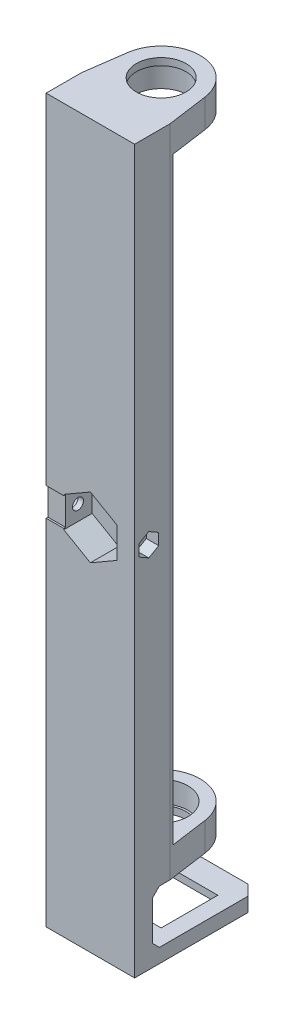
from build123d import *

# Parameters (mm, degrees)
BOSS_EXTRUDE1_DEPTH = 200
SKETCH4_R           = 7
CUT_EXTRUDE2_DEPTH  = 200
SKETCH3_W           = 20
SKETCH3_H           = 169
SKETCH3_W_2         = 21
SKETCH3_H_2         = 15
CUT_EXTRUDE1_DEPTH  = 100
SKETCH5_R           = 7.565
CUT_EXTRUDE3_DEPTH  = 6
CUT_EXTRUDE4_START  = -6
SKETCH6_R           = 7.565
CUT_EXTRUDE4_DEPTH  = 6
CUT_EXTRUDE8_START  = -100
SKETCH11_W          = 7
SKETCH11_H          = 2
CUT_EXTRUDE8_DEPTH  = 4
SKETCH13_W          = 16
SKETCH13_H          = 16
BOSS_EXTRUDE3_DEPTH = 4
SKETCH14_W          = 5
SKETCH14_H          = 15
CUT_EXTRUDE11_DEPTH = 203.546291005
CHAMFER1_SIZE       = 2
SKETCH15_W          = 23
SKETCH15_H          = 23
CUT_EXTRUDE12_DEPTH = 2
CUT_EXTRUDE13_DEPTH = 8
SKETCH17_R          = 1.55
CUT_EXTRUDE14_DEPTH = 203.546291005
SKETCH18_R          = 2.75
CUT_EXTRUDE15_DEPTH = 3.5
CUT_EXTRUDE16_DEPTH = 3.5
FILLET2_R           = 1


with BuildPart() as part:
    # Sketch1 → Boss-Extrude1 (new body)
    with BuildSketch(Plane(origin=(0, 0, 0), x_dir=(1, 0, 0), z_dir=(0, 1, 0))):
        with BuildLine():
            Line((-12.5, -10), (-10.894701926, 1.518377407))
            ThreePointArc((-10.894701926, 1.518377407), (0, 11), (10.894701926, 1.518377407))
            Line((10.894701926, 1.518377407), (12.5, -10))
            Line((12.5, -10), (12.5, -20))
            Line((12.5, -20), (-12.5, -20))
            Line((-12.5, -20), (-12.5, -10))
        make_face()
    extrude(amount=BOSS_EXTRUDE1_DEPTH)

    # Sketch4 → Cut-Extrude2 (cut)
    with BuildSketch(Plane.XZ):
        with Locations(Location((0, 0, 0), (0, 0, 270))):
            Circle(SKETCH4_R)
    extrude(amount=-CUT_EXTRUDE2_DEPTH, mode=Mode.SUBTRACT)

    # Sketch3 → Cut-Extrude1 (cut, symmetric)
    with BuildSketch(Plane(origin=(0, 0, 0), x_dir=(0, 0, -1), z_dir=(1, 0, 0))):
        with Locations((1, 107.5)):
            Rectangle(SKETCH3_W, SKETCH3_H)
        with Locations((0.5, 7.5)):
            Rectangle(SKETCH3_W_2, SKETCH3_H_2)
    extrude(amount=CUT_EXTRUDE1_DEPTH, both=True, mode=Mode.SUBTRACT)

    # Sketch5 → Cut-Extrude3 (cut)
    with BuildSketch(Plane.XZ.offset(-192)):
        with Locations(Location((0, 0, 0), (0, 0, 270))):
            Circle(SKETCH5_R)
    extrude(amount=-CUT_EXTRUDE3_DEPTH, mode=Mode.SUBTRACT)

    # Sketch6 → Cut-Extrude4 (cut)
    with BuildSketch(Plane(origin=(0, 23, 0), x_dir=(1, 0, 0), z_dir=(0, 1, 0)).offset(CUT_EXTRUDE4_START)):
        with Locations(Location((0, 0, 0), (0, 0, 90))):
            Circle(SKETCH6_R)
    extrude(amount=CUT_EXTRUDE4_DEPTH, mode=Mode.SUBTRACT)

    # Sketch11 → Cut-Extrude8 (cut, symmetric)
    with BuildSketch(Plane.XZ.offset(CUT_EXTRUDE8_START)):
        with Locations((-9, 20.5)):
            Rectangle(SKETCH11_W, SKETCH11_H)
    extrude(amount=CUT_EXTRUDE8_DEPTH, both=True, mode=Mode.SUBTRACT)

    # Sketch13 → Boss-Extrude3 (add)
    with BuildSketch(Plane.XZ):
        Polygon((-12.5, 20), (12.5, 20), (12.5, -12), (9.5, -15), (-9.5, -15), (-12.5, -12), align=None)
        Rectangle(SKETCH13_W, SKETCH13_H, mode=Mode.SUBTRACT)
    extrude(amount=BOSS_EXTRUDE3_DEPTH)

    # Sketch14 → Cut-Extrude11 (cut, through all)
    with BuildSketch(Plane.ZY.offset(12.5)):
        with Locations((12.5, 7.5)):
            Rectangle(SKETCH14_W, SKETCH14_H)
    extrude(amount=-CUT_EXTRUDE11_DEPTH, mode=Mode.SUBTRACT)

    # Chamfer1
    chamfer1_edges = [part.edges().sort_by_distance(p)[0] for p in [
        (0, 15, 15),
        (0, 0, 15),
    ]]
    chamfer(chamfer1_edges, length=CHAMFER1_SIZE)

    # Sketch15 → Cut-Extrude12 (cut)
    with BuildSketch(Plane.XZ.offset(4)):
        Rectangle(SKETCH15_W, SKETCH15_H)
    extrude(amount=-CUT_EXTRUDE12_DEPTH, mode=Mode.SUBTRACT)

    # Sketch16 → Cut-Extrude13 (cut)
    with BuildSketch(Plane.XY.offset(20)):
        Polygon((0, 108.660254038), (-7.5, 104.330127019), (-7.5, 95.669872981), (0, 91.339745962), (7.5, 95.669872981), (7.5, 104.330127019), align=None)
    extrude(amount=-CUT_EXTRUDE13_DEPTH, mode=Mode.SUBTRACT)

    # Sketch17 → Cut-Extrude14 (cut, through all)
    with BuildSketch(Plane.ZY.offset(12.5)):
        with Locations((16, 100)):
            Circle(SKETCH17_R)
    extrude(amount=-CUT_EXTRUDE14_DEPTH, mode=Mode.SUBTRACT)

    # Sketch18 → Cut-Extrude15 (cut)
    with BuildSketch(Plane.ZY.offset(12.5)):
        with Locations((16, 100)):
            Circle(SKETCH18_R)
    extrude(amount=-CUT_EXTRUDE15_DEPTH, mode=Mode.SUBTRACT)

    # Sketch19 → Cut-Extrude16 (cut)
    with BuildSketch(Plane(origin=(12.5, 0, 0), x_dir=(0, 0, -1), z_dir=(1, 0, 0))):
        Polygon((-16, 103.233161507), (-18.8, 101.616580754), (-18.8, 98.383419246), (-16, 96.766838493), (-13.2, 98.383419246), (-13.2, 101.616580754), align=None)
    extrude(amount=-CUT_EXTRUDE16_DEPTH, mode=Mode.SUBTRACT)

    # Fillet2
    # the kernel refuses this fillet: 1 mm, written as the material it takes off along each edge
    with BuildSketch(Plane(origin=(-12.5, 100, 16), x_dir=(0, 0, 1), z_dir=(0, -1, 0))) as fillet2_piece_1:
        with BuildLine():
            CenterArc((2.75 + FILLET2_R, -FILLET2_R), FILLET2_R, 90, 90)
            Line((2.75, -FILLET2_R), (2.75, 0))
            Line((2.75, 0), (2.75 + FILLET2_R, 0))
        make_face()
    revolve(axis=Axis((-12.5, 100, 16), (-1, 0, 0)), mode=Mode.SUBTRACT)


solid = part.part
